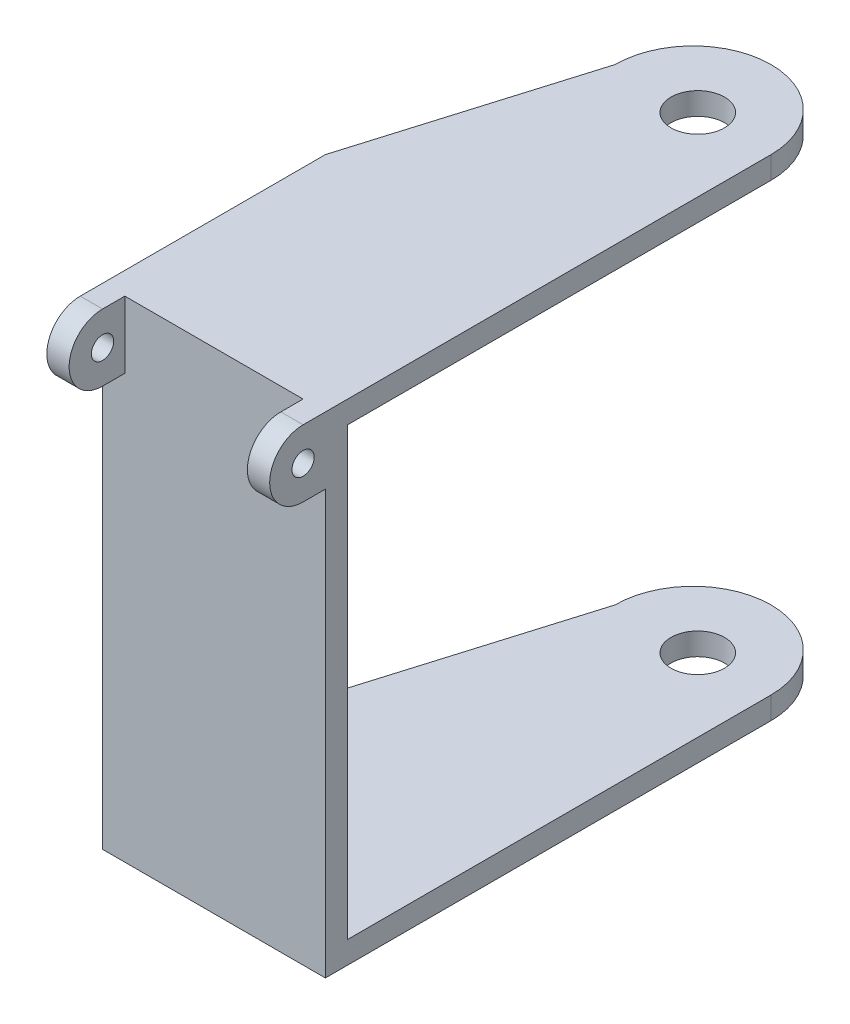
from build123d import *

# Parameters (mm, degrees)
SKETCH_2_W          = 5
SKETCH_2_H          = 10
EXTRUDE_1_DEPTH     = 0.5
CUT_EXTRUDE_1_DEPTH = 1.5
EXTRUDE_3_DEPTH     = 0.5
SKETCH_8_R          = 0.6
CUT_EXTRUDE_2_DEPTH = 0.5
SKETCH_12_W         = 5
SKETCH_12_H         = 0.5
EXTRUDE_4_DEPTH     = 10.5
SKETCH_14_W         = 5
SKETCH_14_H         = 0.5
EXTRUDE_5_DEPTH     = 10
SKETCH_16_W         = 5
SKETCH_16_H         = 0.5
CUT_EXTRUDE_3_DEPTH = 10
CUT_EXTRUDE_4_DEPTH = 10
EXTRUDE_START       = -0.5
EXTRUDE_6_DEPTH     = 0.5
SKETCH_19_R         = 0.6
CUT_EXTRUDE_5_DEPTH = 0.5
SKETCH_23_W         = 0.5
SKETCH_23_H         = 1.5
EXTRUDE_7_DEPTH     = 0.5
EXTRUDE_9_DEPTH     = 0.5
SKETCH_25_R         = 0.25
CUT_EXTRUDE_6_DEPTH = 0.5
CUT_EXTRUDE_START   = -0.5
SKETCH_28_R         = 0.25
CUT_EXTRUDE_7_DEPTH = 0.5


with BuildPart() as part:
    # 草图2 → 凸台-拉伸1 (new body)
    with BuildSketch(Plane(origin=(0, 0, 0), x_dir=(1, 0, 0), z_dir=(0, 1, 0))):
        Rectangle(SKETCH_2_W, SKETCH_2_H)
    extrude(amount=EXTRUDE_1_DEPTH)

    # 草图3 → 切除-拉伸1 (cut)
    with BuildSketch(Plane(origin=(0, 0.5, 0), x_dir=(1, 0, 0), z_dir=(0, 1, 0))):
        Polygon((-2.5, 0), (-1, 5), (-4.597388324, 7.155522044), (-6.097388324, 2.155522044), align=None)
    extrude(amount=-CUT_EXTRUDE_1_DEPTH, mode=Mode.SUBTRACT)

    # 草图6 → 凸台-拉伸3 (add)
    with BuildSketch(Plane.XZ):
        with BuildLine():
            Line((-1, -5), (2.5, -5))
            ThreePointArc((2.5, -5), (0.75, -6.75), (-1, -5))
        make_face()
    extrude(amount=-EXTRUDE_3_DEPTH)

    # 草图8 → 切除-拉伸2 (cut)
    with BuildSketch(Plane(origin=(0, 0.5, 0), x_dir=(1, 0, 0), z_dir=(0, 1, 0))):
        with Locations((0.858368729, 4.996789463)):
            Circle(SKETCH_8_R)
    extrude(amount=-CUT_EXTRUDE_2_DEPTH, mode=Mode.SUBTRACT)

    # 草图12 → 凸台-拉伸4 (add)
    with BuildSketch(Plane.XZ):
        with Locations((0, 4.75)):
            Rectangle(SKETCH_12_W, SKETCH_12_H)
    extrude(amount=EXTRUDE_4_DEPTH)

    # 草图14 → 凸台-拉伸5 (add)
    with BuildSketch(Plane(origin=(0, 0, 4.5), x_dir=(-1, 0, 0), z_dir=(0, 0, -1))):
        with Locations((0, -10.25)):
            Rectangle(SKETCH_14_W, SKETCH_14_H)
    extrude(amount=EXTRUDE_5_DEPTH)

    # 草图16 → 切除-拉伸3 (cut)
    with BuildSketch(Plane(origin=(0, -10, 0), x_dir=(1, 0, 0), z_dir=(0, 1, 0))):
        with Locations((0, 5.25)):
            Rectangle(SKETCH_16_W, SKETCH_16_H)
    extrude(amount=-CUT_EXTRUDE_3_DEPTH, mode=Mode.SUBTRACT)

    # 草图17 → 切除-拉伸4 (cut)
    with BuildSketch(Plane(origin=(0, -10, 0), x_dir=(1, 0, 0), z_dir=(0, 1, 0))):
        Polygon((-1, 5), (-2.5, 0), (-4.860653069, 1.950314005), (-3.360653069, 6.950314005), align=None)
    extrude(amount=-CUT_EXTRUDE_4_DEPTH, mode=Mode.SUBTRACT)

    # 草图18 → 凸台-拉伸6 (add)
    with BuildSketch(Plane(origin=(0, -10, 0), x_dir=(1, 0, 0), z_dir=(0, 1, 0)).offset(EXTRUDE_START)):
        with BuildLine():
            Line((-1, 5), (2.5, 5))
            ThreePointArc((2.5, 5), (0.75, 6.75), (-1, 5))
        make_face()
    extrude(amount=EXTRUDE_6_DEPTH)

    # 草图19 → 切除-拉伸5 (cut)
    with BuildSketch(Plane(origin=(0, -10, 0), x_dir=(1, 0, 0), z_dir=(0, 1, 0))):
        with Locations((0.858368729, 4.996789463)):
            Circle(SKETCH_19_R)
    extrude(amount=-CUT_EXTRUDE_5_DEPTH, mode=Mode.SUBTRACT)

    # 草图23 → 凸台-拉伸7 (add)
    with BuildSketch(Plane.XY.offset(5)):
        with Locations((2.25, -0.25)):
            Rectangle(SKETCH_23_W, SKETCH_23_H)
    extrude_7 = extrude(amount=EXTRUDE_7_DEPTH)

    # 草图24 → 凸台-拉伸9 (add)
    with BuildSketch(Plane(origin=(2.5, 0, 0), x_dir=(0, 0, -1), z_dir=(1, 0, 0))):
        with BuildLine():
            Line((-5.5, 0.5), (-5.5, -1))
            ThreePointArc((-5.5, -1), (-6.25, -0.25), (-5.5, 0.5))
        make_face()
    extrude_9 = extrude(amount=-EXTRUDE_9_DEPTH)

    # 草图25 → 切除-拉伸6 (cut)
    with BuildSketch(Plane(origin=(2.5, 0, 0), x_dir=(0, 0, -1), z_dir=(1, 0, 0))):
        with Locations((-5.5, -0.25)):
            Circle(SKETCH_25_R)
    extrude(amount=-CUT_EXTRUDE_6_DEPTH, mode=Mode.SUBTRACT)

    # 镜向1: 凸台-拉伸7, 凸台-拉伸9 across plane
    add(extrude_7.mirror(Plane(origin=(0, 0, 0), x_dir=(0, 0, 1), z_dir=(1, 0, 0))))
    add(extrude_9.mirror(Plane(origin=(0, 0, 0), x_dir=(0, 0, 1), z_dir=(1, 0, 0))))

    # 草图28 → 切除-拉伸7 (cut)
    with BuildSketch(Plane.ZY.offset(2.5).offset(CUT_EXTRUDE_START)):
        with Locations((5.5, -0.25)):
            Circle(SKETCH_28_R)
    extrude(amount=CUT_EXTRUDE_7_DEPTH, mode=Mode.SUBTRACT)


solid = part.part
